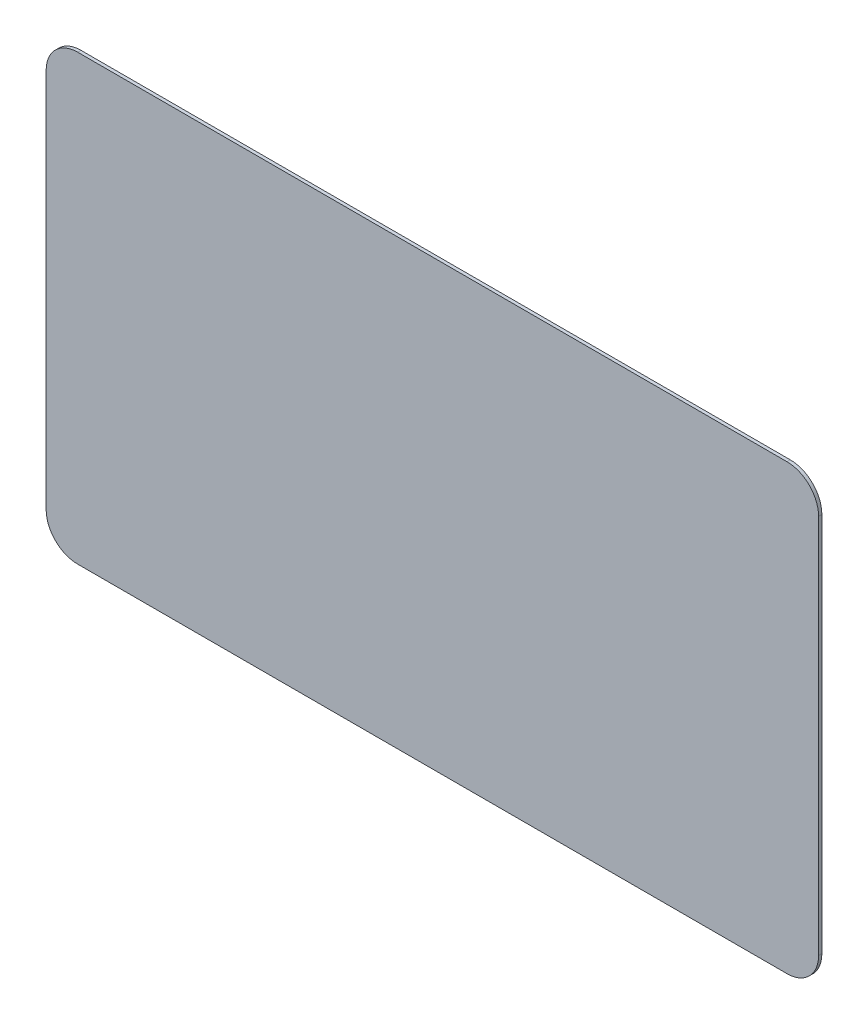
from build123d import *
from OCP.BRepFilletAPI import BRepFilletAPI_MakeChamfer

# Parameters (mm, degrees)
ESQUISSE1_W             = 192.96
ESQUISSE1_H             = 110.76
C_VITRE_DEPTH           = 0.82
CONG_1_R                = 7.88
ESQUISSE2_W             = 171.38
ESQUISSE2_H             = 96.96
C_TOUCH_DEPTH           = 0.8
ESQUISSE3_W             = 166.2
ESQUISSE3_H             = 100.6
BOSS_EXTRU_3_DEPTH      = 4.58
ESQUISSE4_W             = 15
ESQUISSE4_H             = 8
ESQUISSE4_R             = 1.5
ESQUISSE4_W_2           = 8
ESQUISSE4_H_2           = 15
ESQUISSE4_R_2           = 1.25
BOSS_EXTRU_4_DEPTH      = 2.5
CHANFREIN1_SIZE         = 2.5
CHANFREIN1_SIZE_2       = 4.5
BOSS_EXTRU_5_DEPTH      = 0.5
CONG_2_R                = 0.5
ENL_V_MAT_EXTRU_1_DEPTH = 133.991041409
ENL_V_MAT_EXTRU_2_REACH = 149.027
ENL_V_MAT_EXTRU_3_REACH = 149.027


with BuildPart() as part:
    # Esquisse1 → c_vitre (new body)
    with BuildSketch(Plane.XY):
        Rectangle(ESQUISSE1_W, ESQUISSE1_H)
    extrude(amount=C_VITRE_DEPTH)

    # Congé1
    cong_1_edges = [part.edges().sort_by_distance(p)[0] for p in [
        (-96.48, 55.38, 0.41),
        (96.48, 55.38, 0.41),
        (96.48, -55.38, 0.41),
        (-96.48, -55.38, 0.41),
    ]]
    fillet(cong_1_edges, radius=CONG_1_R)

    # Esquisse2 → c_touch (add)
    with BuildSketch(Plane(origin=(0, 0, 0), x_dir=(-1, 0, 0), z_dir=(0, 0, -1))):
        with Locations((5.81, -0.58)):
            Rectangle(ESQUISSE2_W, ESQUISSE2_H)
    extrude(amount=C_TOUCH_DEPTH)

    # Esquisse3 → Boss.-Extru.3 (add)
    with BuildSketch(Plane(origin=(0, 0, -0.8), x_dir=(-1, 0, 0), z_dir=(0, 0, -1))):
        with Locations((-1.49, -1.55)):
            Rectangle(ESQUISSE3_W, ESQUISSE3_H)
    extrude(amount=BOSS_EXTRU_3_DEPTH)

    # Esquisse4 → Boss.-Extru.4 (add)
    # profile 1 of 8: a face of its own
    with BuildSketch(Plane(origin=(0, 0, -5.38), x_dir=(-1, 0, 0), z_dir=(0, 0, -1))):
        with Locations((-64.59, 33.8)):
            Rectangle(ESQUISSE4_W, ESQUISSE4_H)
        with Locations((-64.59, 33.8)):
            Circle(ESQUISSE4_R, mode=Mode.SUBTRACT)
    # profile 2 of 8: a face of its own
    with BuildSketch(Plane(origin=(0, 0, -5.38), x_dir=(-1, 0, 0), z_dir=(0, 0, -1))):
        with Locations((-64.59, -31.812830284)):
            Rectangle(ESQUISSE4_W, ESQUISSE4_H)
        with Locations((-64.59, -31.812830284)):
            Circle(ESQUISSE4_R, mode=Mode.SUBTRACT)
    # profile 3 of 8: a face of its own
    with BuildSketch(Plane(origin=(0, 0, -5.38), x_dir=(-1, 0, 0), z_dir=(0, 0, -1))):
        with Locations((61.61, -31.812830284)):
            Rectangle(ESQUISSE4_W, ESQUISSE4_H)
        with Locations((61.61, -31.812830284)):
            Circle(ESQUISSE4_R, mode=Mode.SUBTRACT)
    # profile 4 of 8: a face of its own
    with BuildSketch(Plane(origin=(0, 0, -5.38), x_dir=(-1, 0, 0), z_dir=(0, 0, -1))):
        with Locations((61.61, 33.837169716)):
            Rectangle(ESQUISSE4_W, ESQUISSE4_H)
        with Locations((61.61, 33.837169716)):
            Circle(ESQUISSE4_R, mode=Mode.SUBTRACT)
    # profile 5 of 8: a face of its own
    with BuildSketch(Plane(origin=(0, 0, -5.38), x_dir=(-1, 0, 0), z_dir=(0, 0, -1))):
        with Locations((-35.49, 27.95)):
            Rectangle(ESQUISSE4_W_2, ESQUISSE4_H_2)
        with Locations((-35.49, 27.95)):
            Circle(ESQUISSE4_R_2, mode=Mode.SUBTRACT)
    # profile 6 of 8: a face of its own
    with BuildSketch(Plane(origin=(0, 0, -5.38), x_dir=(-1, 0, 0), z_dir=(0, 0, -1))):
        with Locations((-35.49, -21.05)):
            Rectangle(ESQUISSE4_W_2, ESQUISSE4_H_2)
        with Locations((-35.49, -21.05)):
            Circle(ESQUISSE4_R_2, mode=Mode.SUBTRACT)
    # profile 7 of 8: a face of its own
    with BuildSketch(Plane(origin=(0, 0, -5.38), x_dir=(-1, 0, 0), z_dir=(0, 0, -1))):
        with Locations((22.51, -21.05)):
            Rectangle(ESQUISSE4_W_2, ESQUISSE4_H_2)
        with Locations((22.51, -21.05)):
            Circle(ESQUISSE4_R_2, mode=Mode.SUBTRACT)
    # profile 8 of 8: a face of its own
    with BuildSketch(Plane(origin=(0, 0, -5.38), x_dir=(-1, 0, 0), z_dir=(0, 0, -1))):
        with Locations((22.51, 27.95)):
            Rectangle(ESQUISSE4_W_2, ESQUISSE4_H_2)
        with Locations((22.51, 27.95)):
            Circle(ESQUISSE4_R_2, mode=Mode.SUBTRACT)
    extrude(amount=BOSS_EXTRU_4_DEPTH)

    # Chanfrein1
    chanfrein1_edges_1 = [part.edges().sort_by_distance(p)[0] for p in [
        (-69.11, -31.812830284, -7.88),
    ]]
    chanfrein1_side_1 = [part.faces().sort_by_distance(p)[0] for p in [
        (-69.11, -31.812830284, -7.83),
    ]]
    chanfrein1_edges_2 = [part.edges().sort_by_distance(p)[0] for p in [
        (-54.11, -31.812830284, -7.88),
    ]]
    chanfrein1_side_2 = [part.faces().sort_by_distance(p)[0] for p in [
        (-54.11, -31.812830284, -7.83),
    ]]
    chanfrein1_edges_3 = [part.edges().sort_by_distance(p)[0] for p in [
        (-22.51, -28.55, -7.88),
    ]]
    chanfrein1_side_3 = [part.faces().sort_by_distance(p)[0] for p in [
        (-22.51, -28.55, -7.83),
    ]]
    chanfrein1_edges_4 = [part.edges().sort_by_distance(p)[0] for p in [
        (-22.51, -13.55, -7.88),
    ]]
    chanfrein1_side_4 = [part.faces().sort_by_distance(p)[0] for p in [
        (-22.51, -13.55, -7.83),
    ]]
    chanfrein1_edges_5 = [part.edges().sort_by_distance(p)[0] for p in [
        (-69.11, 33.837169716, -7.88),
    ]]
    chanfrein1_side_5 = [part.faces().sort_by_distance(p)[0] for p in [
        (-69.11, 33.837169716, -7.83),
    ]]
    chanfrein1_edges_6 = [part.edges().sort_by_distance(p)[0] for p in [
        (-54.11, 33.837169716, -7.88),
    ]]
    chanfrein1_side_6 = [part.faces().sort_by_distance(p)[0] for p in [
        (-54.11, 33.837169716, -7.83),
    ]]
    chanfrein1_edges_7 = [part.edges().sort_by_distance(p)[0] for p in [
        (-22.51, 20.45, -7.88),
    ]]
    chanfrein1_side_7 = [part.faces().sort_by_distance(p)[0] for p in [
        (-22.51, 20.45, -7.83),
    ]]
    chanfrein1_edges_8 = [part.edges().sort_by_distance(p)[0] for p in [
        (-22.51, 35.45, -7.88),
    ]]
    chanfrein1_side_8 = [part.faces().sort_by_distance(p)[0] for p in [
        (-22.51, 35.45, -7.83),
    ]]
    chanfrein1_edges_9 = [part.edges().sort_by_distance(p)[0] for p in [
        (35.49, 35.45, -7.88),
    ]]
    chanfrein1_side_9 = [part.faces().sort_by_distance(p)[0] for p in [
        (35.49, 35.45, -7.83),
    ]]
    chanfrein1_edges_10 = [part.edges().sort_by_distance(p)[0] for p in [
        (57.09, 33.8, -7.88),
    ]]
    chanfrein1_side_10 = [part.faces().sort_by_distance(p)[0] for p in [
        (57.09, 33.8, -7.83),
    ]]
    chanfrein1_edges_11 = [part.edges().sort_by_distance(p)[0] for p in [
        (72.09, 33.8, -7.88),
    ]]
    chanfrein1_side_11 = [part.faces().sort_by_distance(p)[0] for p in [
        (72.09, 33.8, -7.83),
    ]]
    chanfrein1_edges_12 = [part.edges().sort_by_distance(p)[0] for p in [
        (35.49, 20.45, -7.88),
    ]]
    chanfrein1_side_12 = [part.faces().sort_by_distance(p)[0] for p in [
        (35.49, 20.45, -7.83),
    ]]
    chanfrein1_edges_13 = [part.edges().sort_by_distance(p)[0] for p in [
        (35.49, -13.55, -7.88),
    ]]
    chanfrein1_side_13 = [part.faces().sort_by_distance(p)[0] for p in [
        (35.49, -13.55, -7.83),
    ]]
    chanfrein1_edges_14 = [part.edges().sort_by_distance(p)[0] for p in [
        (35.49, -28.55, -7.88),
    ]]
    chanfrein1_side_14 = [part.faces().sort_by_distance(p)[0] for p in [
        (35.49, -28.55, -7.83),
    ]]
    chanfrein1_edges_15 = [part.edges().sort_by_distance(p)[0] for p in [
        (57.09, -31.812830284, -7.88),
    ]]
    chanfrein1_side_15 = [part.faces().sort_by_distance(p)[0] for p in [
        (57.09, -31.812830284, -7.83),
    ]]
    chanfrein1_edges_16 = [part.edges().sort_by_distance(p)[0] for p in [
        (72.09, -31.812830284, -7.88),
    ]]
    chanfrein1_side_16 = [part.faces().sort_by_distance(p)[0] for p in [
        (72.09, -31.812830284, -7.83),
    ]]
    chanfrein1 = BRepFilletAPI_MakeChamfer(part.part.solid().wrapped)
    for e in chanfrein1_edges_1:
        chanfrein1.Add(CHANFREIN1_SIZE - 0.0001, CHANFREIN1_SIZE_2 - 0.0001, e.wrapped, chanfrein1_side_1[0].wrapped)
    for e in chanfrein1_edges_2:
        chanfrein1.Add(CHANFREIN1_SIZE - 0.0001, CHANFREIN1_SIZE_2 - 0.0001, e.wrapped, chanfrein1_side_2[0].wrapped)
    for e in chanfrein1_edges_3:
        chanfrein1.Add(CHANFREIN1_SIZE - 0.0001, CHANFREIN1_SIZE_2 - 0.0001, e.wrapped, chanfrein1_side_3[0].wrapped)
    for e in chanfrein1_edges_4:
        chanfrein1.Add(CHANFREIN1_SIZE - 0.0001, CHANFREIN1_SIZE_2 - 0.0001, e.wrapped, chanfrein1_side_4[0].wrapped)
    for e in chanfrein1_edges_5:
        chanfrein1.Add(CHANFREIN1_SIZE - 0.0001, CHANFREIN1_SIZE_2 - 0.0001, e.wrapped, chanfrein1_side_5[0].wrapped)
    for e in chanfrein1_edges_6:
        chanfrein1.Add(CHANFREIN1_SIZE - 0.0001, CHANFREIN1_SIZE_2 - 0.0001, e.wrapped, chanfrein1_side_6[0].wrapped)
    for e in chanfrein1_edges_7:
        chanfrein1.Add(CHANFREIN1_SIZE - 0.0001, CHANFREIN1_SIZE_2 - 0.0001, e.wrapped, chanfrein1_side_7[0].wrapped)
    for e in chanfrein1_edges_8:
        chanfrein1.Add(CHANFREIN1_SIZE - 0.0001, CHANFREIN1_SIZE_2 - 0.0001, e.wrapped, chanfrein1_side_8[0].wrapped)
    for e in chanfrein1_edges_9:
        chanfrein1.Add(CHANFREIN1_SIZE - 0.0001, CHANFREIN1_SIZE_2 - 0.0001, e.wrapped, chanfrein1_side_9[0].wrapped)
    for e in chanfrein1_edges_10:
        chanfrein1.Add(CHANFREIN1_SIZE - 0.0001, CHANFREIN1_SIZE_2 - 0.0001, e.wrapped, chanfrein1_side_10[0].wrapped)
    for e in chanfrein1_edges_11:
        chanfrein1.Add(CHANFREIN1_SIZE - 0.0001, CHANFREIN1_SIZE_2 - 0.0001, e.wrapped, chanfrein1_side_11[0].wrapped)
    for e in chanfrein1_edges_12:
        chanfrein1.Add(CHANFREIN1_SIZE - 0.0001, CHANFREIN1_SIZE_2 - 0.0001, e.wrapped, chanfrein1_side_12[0].wrapped)
    for e in chanfrein1_edges_13:
        chanfrein1.Add(CHANFREIN1_SIZE - 0.0001, CHANFREIN1_SIZE_2 - 0.0001, e.wrapped, chanfrein1_side_13[0].wrapped)
    for e in chanfrein1_edges_14:
        chanfrein1.Add(CHANFREIN1_SIZE - 0.0001, CHANFREIN1_SIZE_2 - 0.0001, e.wrapped, chanfrein1_side_14[0].wrapped)
    for e in chanfrein1_edges_15:
        chanfrein1.Add(CHANFREIN1_SIZE - 0.0001, CHANFREIN1_SIZE_2 - 0.0001, e.wrapped, chanfrein1_side_15[0].wrapped)
    for e in chanfrein1_edges_16:
        chanfrein1.Add(CHANFREIN1_SIZE - 0.0001, CHANFREIN1_SIZE_2 - 0.0001, e.wrapped, chanfrein1_side_16[0].wrapped)
    add(Compound.cast(chanfrein1.Shape()), mode=Mode.REPLACE)  # a hair under: the kernel refuses the full size

    # Esquisse5 → Boss.-Extru.5 (add)
    with BuildSketch(Plane(origin=(0, 0, -5.38), x_dir=(-1, 0, 0), z_dir=(0, 0, -1))):
        with BuildLine():
            Line((47.51, 45.85), (-50.49, 45.85))
            ThreePointArc((-50.49, 45.85), (-51.99, 44.35), (-50.49, 42.85))
            Line((-50.49, 42.85), (47.51, 42.85))
            ThreePointArc((47.51, 42.85), (49.01, 44.35), (47.51, 45.85))
        make_face()
        with BuildLine():
            Line((27.51, -43.85), (-30.49, -43.85))
            ThreePointArc((-30.49, -43.85), (-31.99, -45.35), (-30.49, -46.85))
            Line((-30.49, -46.85), (27.51, -46.85))
            ThreePointArc((27.51, -46.85), (29.01, -45.35), (27.51, -43.85))
        make_face()
    extrude(amount=BOSS_EXTRU_5_DEPTH)

    # Congé2
    cong_2_edges = [part.edges().sort_by_distance(p)[0] for p in [
        (1.49, 42.85, -5.88),
        (51.99, 44.35, -5.88),
        (1.49, 45.85, -5.88),
        (1.49, -46.85, -5.88),
        (31.99, -45.35, -5.88),
        (1.49, -43.85, -5.88),
        (-49.01, 44.35, -5.88),
        (-29.01, -45.35, -5.88),
    ]]
    fillet(cong_2_edges, radius=CONG_2_R - 0.0001)  # a hair under: the kernel refuses the full size

    # Esquisse7 → Enlèv. mat.-Extru.1 (cut, through all)
    with BuildSketch(Plane.XZ.offset(35.812830284)):
        Polygon((58.737300823, -5.38), (70.442699177, -5.38), (67.382699177, -7.08), (61.797300823, -7.08), align=None)
        Polygon((-67.462699177, -5.38), (-64.402699177, -7.08), (-58.817300823, -7.08), (-55.757300823, -5.38), align=None)
    extrude(amount=-ENL_V_MAT_EXTRU_1_DEPTH, mode=Mode.SUBTRACT)

    # Enlèv. mat.-Extru.2: up to this face of the body (flat: up to its plane)
    enl_v_mat_extru_2_end = Plane(part.part.faces().sort_by_distance((-26.51, -21.05, -6.451430159))[0])
    # Esquisse8 → Enlèv. mat.-Extru.2 (cut, up to the picked face)
    with BuildSketch(Plane(origin=(39.49, 0, 0), x_dir=(0, 0, -1), z_dir=(1, 0, 0)), mode=Mode.PRIVATE) as enl_v_mat_extru_2_sk1:
        Polygon((5.38, -15.197300823), (5.38, -26.902699177), (7.08, -23.842699177), (7.08, -18.257300823), align=None)
    enl_v_mat_extru_2_tool1 = split(extrude(enl_v_mat_extru_2_sk1.sketch, amount=-ENL_V_MAT_EXTRU_2_REACH, mode=Mode.PRIVATE), bisect_by=enl_v_mat_extru_2_end, keep=Keep.BOTH, mode=Mode.PRIVATE)
    add(enl_v_mat_extru_2_tool1.solids().sort_by(Axis((39.49, -21.05, -6.129715), (-1, 0, 0)))[0], mode=Mode.SUBTRACT)

    # Enlèv. mat.-Extru.3: up to this face of the body (flat: up to its plane)
    enl_v_mat_extru_3_end = Plane(part.part.faces().sort_by_distance((-26.51, 27.95, -6.451430159))[0])
    # Esquisse9 → Enlèv. mat.-Extru.3 (cut, up to the picked face)
    with BuildSketch(Plane(origin=(39.49, 0, 0), x_dir=(0, 0, -1), z_dir=(1, 0, 0)), mode=Mode.PRIVATE) as enl_v_mat_extru_3_sk1:
        Polygon((5.38, 22.097300823), (5.38, 33.802699177), (7.08, 30.742699177), (7.08, 25.157300823), align=None)
    enl_v_mat_extru_3_tool1 = split(extrude(enl_v_mat_extru_3_sk1.sketch, amount=-ENL_V_MAT_EXTRU_3_REACH, mode=Mode.PRIVATE), bisect_by=enl_v_mat_extru_3_end, keep=Keep.BOTH, mode=Mode.PRIVATE)
    add(enl_v_mat_extru_3_tool1.solids().sort_by(Axis((39.49, 27.95, -6.129715), (-1, 0, 0)))[0], mode=Mode.SUBTRACT)


solid = part.part
